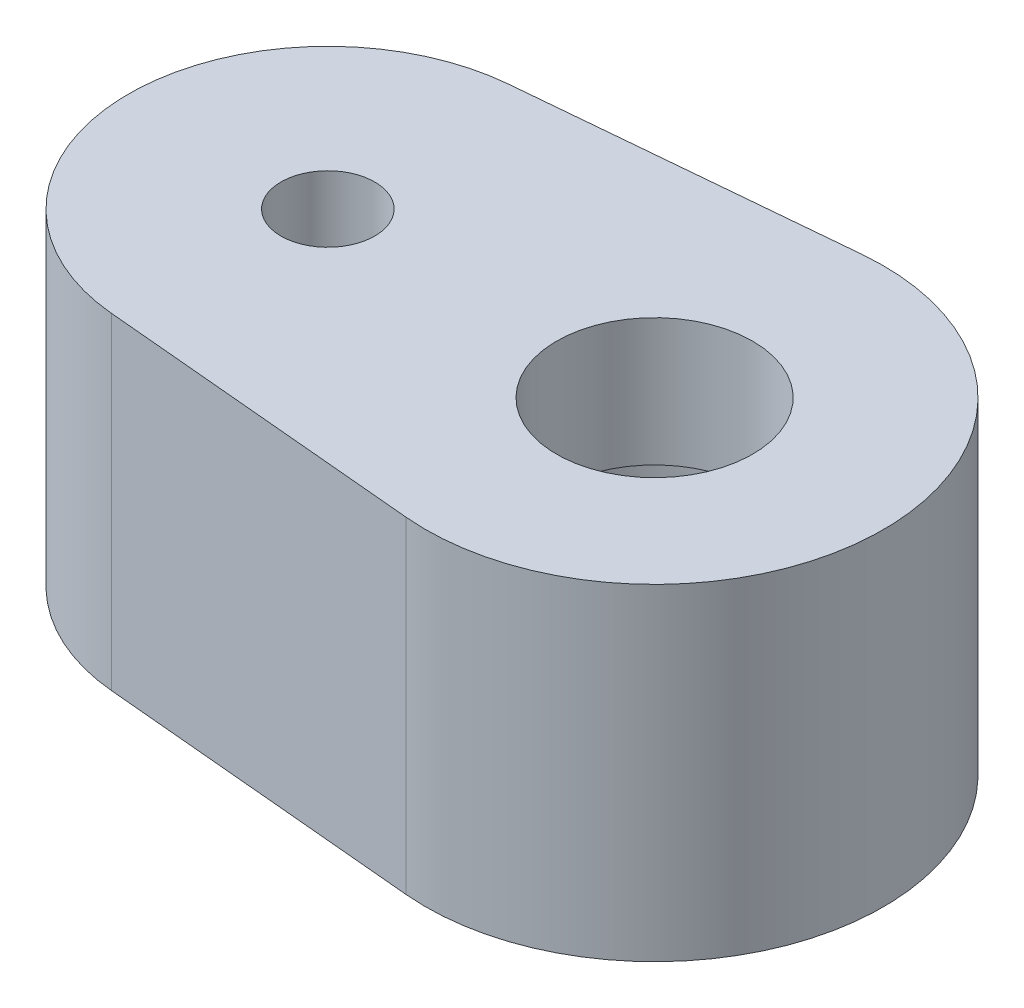
from build123d import *

# Parameters (mm, degrees)
BOSS_EXTRUDE1_DEPTH      = 1
BOSS_EXTRUDE1_DEPTH_BACK = 1
CUT_EXTRUDE1_REACH       = 6.041
SKETCH5_R                = 0.28702


with BuildPart() as part:
    # Sketch1 → Boss-Extrude1 (new, two sides: drawn at the far end of the back side and taken through both)
    with BuildSketch(Plane(origin=(0, 0, 0), x_dir=(1, 0, 0), z_dir=(0, 1, 0)).offset(-BOSS_EXTRUDE1_DEPTH_BACK)):
        with BuildLine():
            Line((-2.1098, 1.215048954), (-0.126, 1.394318472))
            ThreePointArc((-0.126, 1.394318472), (1.4, 0), (-0.126, -1.394318472))
            Line((-0.126, -1.394318472), (-2.1098, -1.215048954))
            ThreePointArc((-2.1098, -1.215048954), (-3.22, 0), (-2.1098, 1.215048954))
        make_face()
    extrude(amount=BOSS_EXTRUDE1_DEPTH + BOSS_EXTRUDE1_DEPTH_BACK)

    # Sketch4 → Cut-Revolve1 (revolve, cut)
    with BuildSketch(Plane.XY):
        Polygon((0.85, 0), (0.85, 0.075), (0.6, 0.219337567), (0.6, 1), (0, 1), (0, -1), (0.6, -1), (0.6, -0.219337567), (0.85, -0.075), align=None)
    revolve(axis=Axis((0, -1, 0), (0, 1, 0)), mode=Mode.SUBTRACT)

    # Sketch5 → Cut-Extrude1 (cut, up to next)
    with BuildSketch(Plane(origin=(0, 1, 0), x_dir=(1, 0, 0), z_dir=(0, 1, 0)), mode=Mode.PRIVATE) as cut_extrude1_sk1:
        with Locations((-2, 0)):
            Circle(SKETCH5_R)
    cut_extrude1_tool1 = extrude(cut_extrude1_sk1.sketch, amount=-CUT_EXTRUDE1_REACH, mode=Mode.PRIVATE) & part.part
    add(cut_extrude1_tool1.solids().sort_by_distance((-2, 1, 0))[0], mode=Mode.SUBTRACT)


solid = part.part
